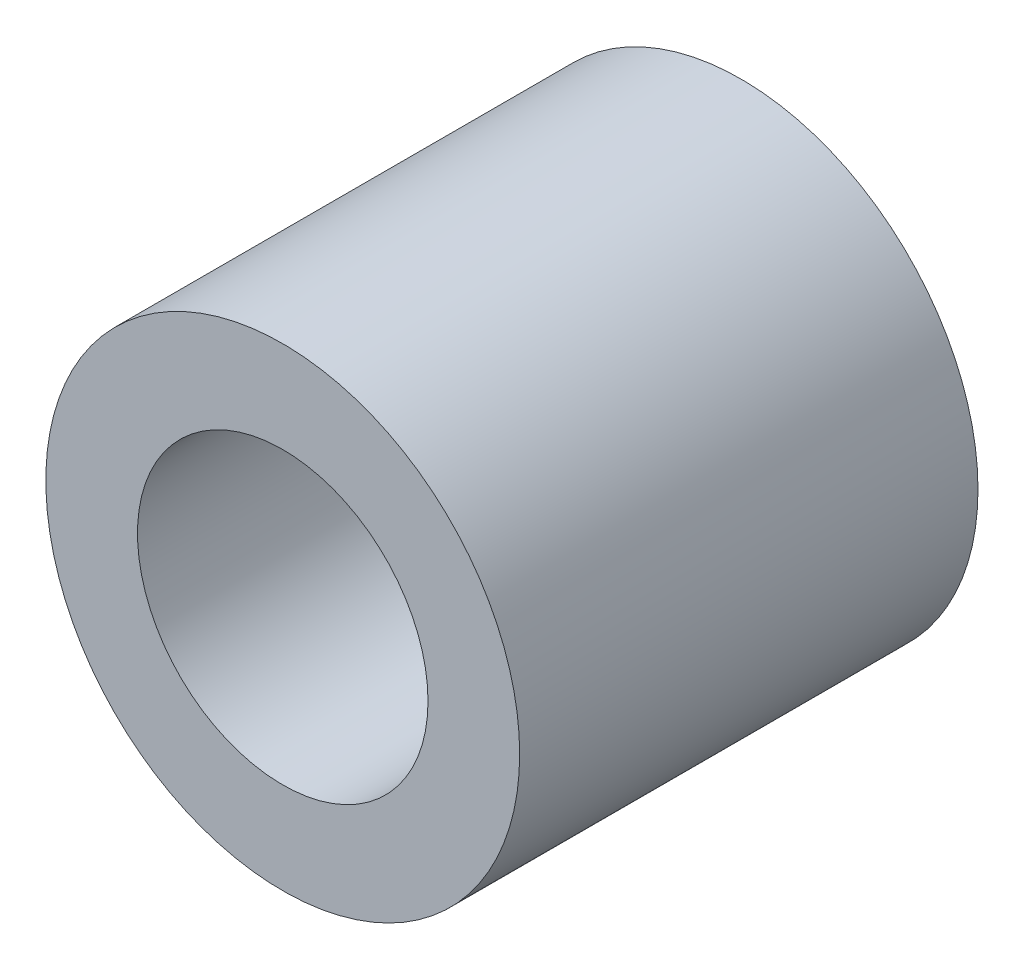
from build123d import *

# Parameters (mm, degrees)
SKETCH1_R           = 6.565
SKETCH1_R_2         = 4.025
BOSS_EXTRUDE1_DEPTH = 12.7


with BuildPart() as part:
    # Sketch1 → Boss-Extrude1 (new body)
    with BuildSketch(Plane.XY):
        Circle(SKETCH1_R)
        Circle(SKETCH1_R_2, mode=Mode.SUBTRACT)
    extrude(amount=BOSS_EXTRUDE1_DEPTH)


solid = part.part
